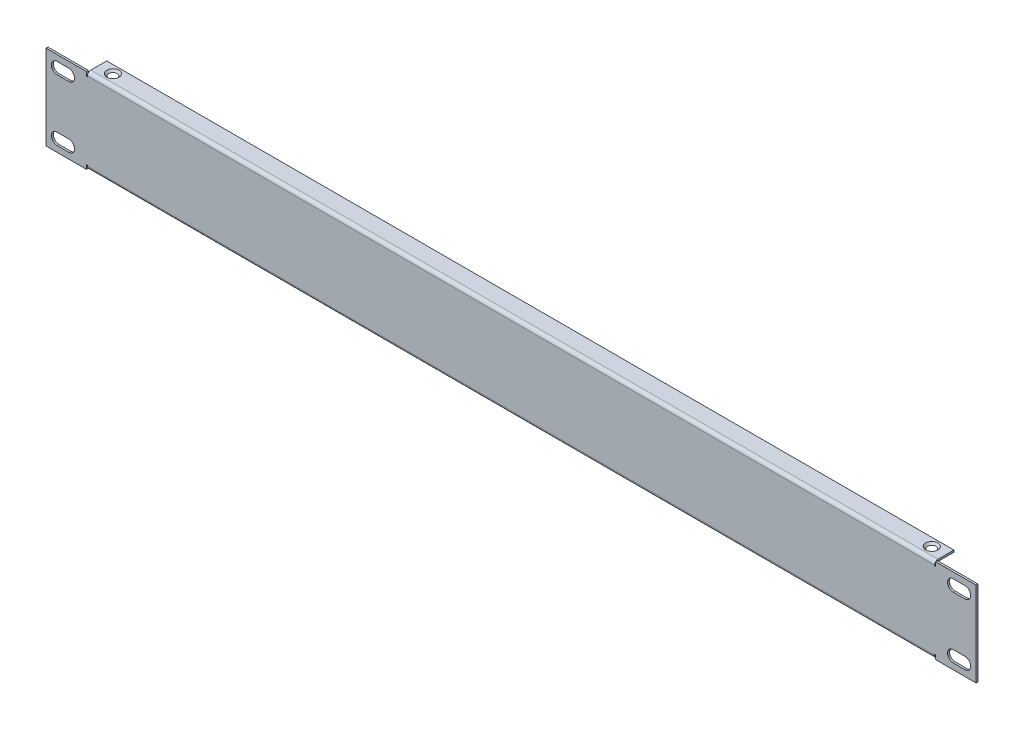
from build123d import *

# Parameters (mm, degrees)
SKETCH1_W                                           = 241.3
SKETCH1_H                                           = 22
BASE_FLANGE_DEPTH                                   = 1
EDGE_FLANGE_MOUNING_STRIP_W                         = 5.4732
EDGE_FLANGE_MOUNING_STRIP_H                         = 1
EDGE_FLANGE_MOUNING_STRIP_CUT_DEPTH                 = 219.8
EDGE_FLANGE_MOUNING_RELIEF_W                        = 5.9732
EDGE_FLANGE_MOUNING_RELIEF_H                        = 0.5
EDGE_FLANGE_MOUNING_RELIEF_CUT_DEPTH                = 1
EDGE_FLANGE_MOUNING_DEPTH                           = 219.8
CUT_EXTRUDE_MOUNTING_DEPTH                          = 1
CSK_FOR_M3_COUNTERSUNK_FLAT_HEAD_SCREW5_D           = 3.2
CSK_FOR_M3_COUNTERSUNK_FLAT_HEAD_SCREW5_CSINK_D     = 6.3
CSK_FOR_M3_COUNTERSUNK_FLAT_HEAD_SCREW5_CSINK_ANGLE = 90
CSK_FOR_M3_COUNTERSUNK_FLAT_HEAD_SCREW6_D           = 3.2
CSK_FOR_M3_COUNTERSUNK_FLAT_HEAD_SCREW6_CSINK_D     = 6.3
CSK_FOR_M3_COUNTERSUNK_FLAT_HEAD_SCREW6_CSINK_ANGLE = 90


# Sheet-metal steps are written as plain solids
with BuildPart() as part:
    # Sketch1 → Base-Flange (new body)
    with BuildSketch(Plane.XY):
        with Locations((-120.65, 11)):
            Rectangle(SKETCH1_W, SKETCH1_H)
    extrude(amount=-BASE_FLANGE_DEPTH)

    # Edge-Flange-Mouning strip (across the edge) → Edge-Flange-Mouning strip cut (cut)
    with BuildSketch(Plane(origin=(-219.8, 22, -1), x_dir=(0, -1, 0), z_dir=(1, 0, 0))):
        with Locations((-1, -0.5)):
            Rectangle(EDGE_FLANGE_MOUNING_STRIP_W, EDGE_FLANGE_MOUNING_STRIP_H)
    extrude(amount=EDGE_FLANGE_MOUNING_STRIP_CUT_DEPTH, mode=Mode.SUBTRACT)

    # Edge-Flange-Mouning relief (on the sheet) → Edge-Flange-Mouning relief cut (cut)
    with BuildSketch(Plane(origin=(-219.8, 20.2634, -1), x_dir=(0, -1, 0), z_dir=(0, 0, -1))):
        with Locations((-2.4866, 0.25)):
            Rectangle(EDGE_FLANGE_MOUNING_RELIEF_W, EDGE_FLANGE_MOUNING_RELIEF_H)
    extrude(amount=-EDGE_FLANGE_MOUNING_RELIEF_CUT_DEPTH, mode=Mode.SUBTRACT)

    # Edge-Flange-Mouning section (across the edge) → Edge-Flange-Mouning (add)
    with BuildSketch(Plane(origin=(-219.8, 22, -1), x_dir=(0, -1, 0), z_dir=(1, 0, 0))):
        with BuildLine():
            Line((0, 0.7366), (0, 9))
            Line((0, 9), (1, 9))
            Line((1, 9), (1, 0.7366))
            ThreePointArc((1, 0.7366), (1.215745145, 0.215745145), (1.7366, 0))
            Line((1.7366, 0), (1.7366, -1))
            ThreePointArc((1.7366, -1), (0.508638364, -0.491361636), (0, 0.7366))
        make_face()
    extrude(amount=EDGE_FLANGE_MOUNING_DEPTH)

    # Sketch13 → Cut-Extrude-Mounting (cut)
    with BuildSketch(Plane.XY):
        with BuildLine():
            Line((-229.5, 12.9), (-235.5, 12.9))
            ThreePointArc((-235.5, 12.9), (-238.5, 15.9), (-235.5, 18.9))
            Line((-235.5, 18.9), (-229.5, 18.9))
            ThreePointArc((-229.5, 18.9), (-226.5, 15.9), (-229.5, 12.9))
        make_face()
    extrude(amount=-CUT_EXTRUDE_MOUNTING_DEPTH, mode=Mode.SUBTRACT)

    # Mirror-Vertical: part across plane


with BuildPart() as part_1:
    add(part.part)
    add(part.part.mirror(Plane(origin=(0, 0, -1), x_dir=(0, 0, 1), z_dir=(1, 0, 0))))

    # Mirror-Horizontal: part across face


with BuildPart() as part_2:
    add(part_1.part)
    add(part_1.part.mirror(Plane(origin=(0, 0, -0.5), x_dir=(0, 0, 1), z_dir=(0, -1, 0))))

    # CSK for M3 Countersunk Flat Head Screw5 (through all)
    with Locations(Plane(origin=(0, 22, 0), x_dir=(1, 0, 0), z_dir=(0, 1, 0))):
        with Locations((-212.4317, 5.8683), (212.4317, 5.8683)):
            CounterSinkHole(CSK_FOR_M3_COUNTERSUNK_FLAT_HEAD_SCREW5_D / 2, CSK_FOR_M3_COUNTERSUNK_FLAT_HEAD_SCREW5_CSINK_D / 2, counter_sink_angle=CSK_FOR_M3_COUNTERSUNK_FLAT_HEAD_SCREW5_CSINK_ANGLE)

    # CSK for M3 Countersunk Flat Head Screw6 (through all)
    with Locations(Plane(origin=(0, -22, 0), x_dir=(-1, 0, 0), z_dir=(0, -1, 0))):
        with Locations((-212.4317, 5.8683), (212.4317, 5.8683)):
            CounterSinkHole(CSK_FOR_M3_COUNTERSUNK_FLAT_HEAD_SCREW6_D / 2, CSK_FOR_M3_COUNTERSUNK_FLAT_HEAD_SCREW6_CSINK_D / 2, counter_sink_angle=CSK_FOR_M3_COUNTERSUNK_FLAT_HEAD_SCREW6_CSINK_ANGLE)


solid = part_2.part
